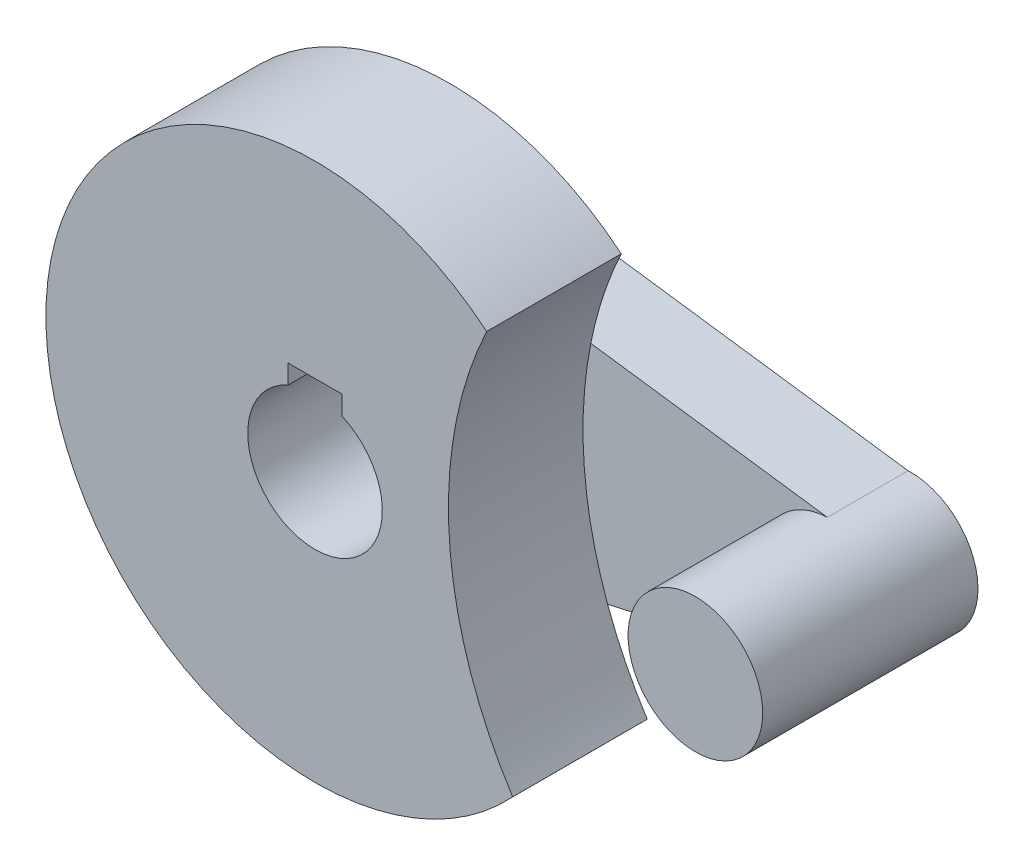
from build123d import *
from build123d.topology import SkipClean

# Parameters (mm, degrees)
SKETCH_1_R          = 10
SKETCH_1_R_2        = 2.5
EXTRUDE_1_DEPTH     = 5
SKETCH_2_R          = 15
CUT_EXTRUDE_1_DEPTH = 5
EXTRUDE_START       = 3
SKETCH_3_R          = 2.5
EXTRUDE_2_DEPTH     = 3
SKETCH_4_R          = 2.5
EXTRUDE_3_DEPTH     = 5
SKETCH_5_W          = 2
SKETCH_5_H          = 1
CUT_EXTRUDE_2_DEPTH = 21.990484753


with BuildPart() as part:
    # 草图1 → 凸台-拉伸1 (new body)
    with BuildSketch(Plane.XY):
        Circle(SKETCH_1_R)
        Circle(SKETCH_1_R_2, mode=Mode.SUBTRACT)
    extrude(amount=EXTRUDE_1_DEPTH)

    # 草图2 → 切除-拉伸1 (cut)
    with BuildSketch(Plane(origin=(0, 0, 0), x_dir=(-1, 0, 0), z_dir=(0, 0, -1))):
        with Locations((-19.955808724, 1.328795767)):
            Circle(SKETCH_2_R)
    extrude(amount=-CUT_EXTRUDE_1_DEPTH, mode=Mode.SUBTRACT)

    # 草图3 → 凸台-拉伸2 (add)
    with SkipClean():  # the faces are left unmerged after this step: merging them gives an invalid solid
        with BuildSketch(Plane(origin=(0, 0, 0), x_dir=(-1, 0, 0), z_dir=(0, 0, -1)).offset(EXTRUDE_START)):
            with BuildLine():
                Line((-14.033505879, 3.051346054), (0.163638991, 4.997321511))
                ThreePointArc((0.163638991, 4.997321511), (4.961120501, -0.622320962), (-1.075733127, -4.882908789))
                Line((-1.075733127, -4.882908789), (-14.669175898, -1.888194504))
                ThreePointArc((-14.669175898, -1.888194504), (-16.610861535, 0.872353736), (-14.033505879, 3.051346054))
            make_face()
            Circle(SKETCH_3_R, mode=Mode.SUBTRACT)
        extrude(amount=-EXTRUDE_2_DEPTH)

    # 草图4 → 凸台-拉伸3 (add)
    with SkipClean():  # the faces are left unmerged after this step: merging them gives an invalid solid
        with BuildSketch(Plane.XY):
            with Locations((14.131309334, 0.55325989)):
                Circle(SKETCH_4_R)
        extrude(amount=EXTRUDE_3_DEPTH)

    # 草图5 → 切除-拉伸2 (cut, through all)
    with SkipClean():  # the faces are left unmerged after this step: merging them gives an invalid solid
        with BuildSketch(Plane.XY.offset(5)):
            with Locations((0, 2.5)):
                Rectangle(SKETCH_5_W, SKETCH_5_H)
        extrude(amount=-CUT_EXTRUDE_2_DEPTH, mode=Mode.SUBTRACT)
    add(part.part.scale(1), mode=Mode.REPLACE)  # the faces are merged on a copy


solid = part.part
